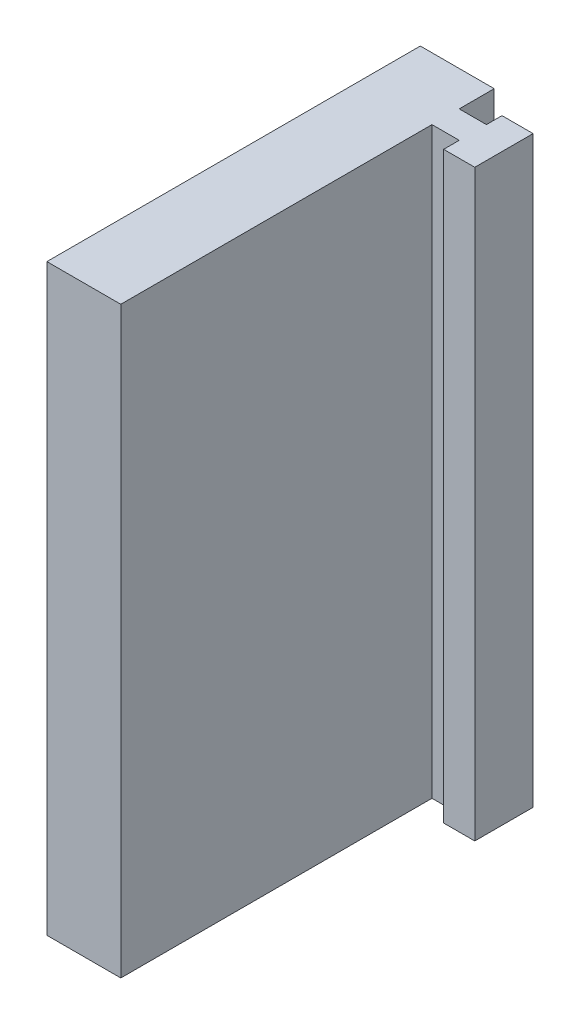
from build123d import *

# Parameters (mm, degrees)
ESTRUSIONE_ESTRUSIONE1_DEPTH = 150
TAGLIO_ESTRUSIONE1_DEPTH     = 145


with BuildPart() as part:
    # Schizzo2 → Estrusione-Estrusione1 (new body)
    with BuildSketch(Plane(origin=(0, 0, 0), x_dir=(1, 0, 0), z_dir=(0, 1, 0))):
        Polygon((19, 96), (19, 87), (26, 87), (26, 91), (34, 91), (34, 76), (26, 76), (26, 80), (19, 80), (19, 0), (0, 0), (0, 96), align=None)
    extrude(amount=ESTRUSIONE_ESTRUSIONE1_DEPTH)

    # Schizzo3 → Taglio-Estrusione1 (cut)
    with BuildSketch(Plane.XZ):
        with BuildLine():
            Line((9.122498999, -91), (5, -91))
            Line((5, -91), (5, -72))
            Line((5, -72), (9.122498999, -72))
            ThreePointArc((9.122498999, -72), (16, -81.5), (9.122498999, -91))
        make_face()
    extrude(amount=-TAGLIO_ESTRUSIONE1_DEPTH, mode=Mode.SUBTRACT)


solid = part.part
